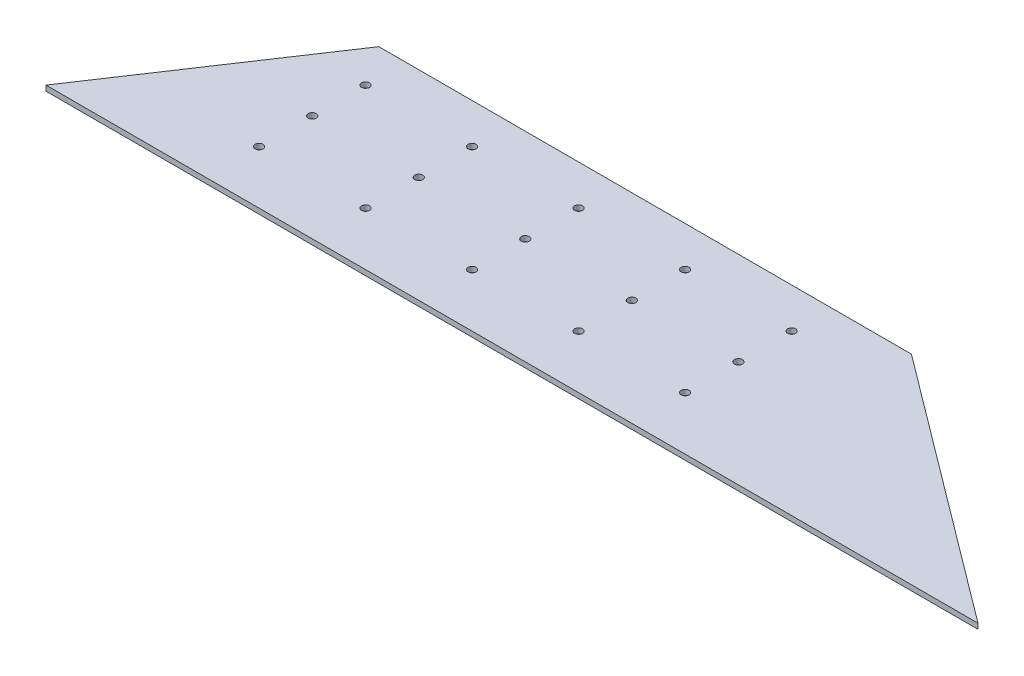
from build123d import *

# Parameters (mm, degrees)
SKETCH1_R           = 1.5
BOSS_EXTRUDE1_DEPTH = 2


with BuildPart() as part:
    # Sketch1 → Boss-Extrude1 (new body)
    with BuildSketch(Plane(origin=(0, 0, 0), x_dir=(1, 0, 0), z_dir=(0, 1, 0))):
        Polygon((-17.984046201, 0), (332.015953799, 0), (232.015953799, 75), (32.015953799, 75), align=None)
        with Locations((42.015953799, 20)):
            Circle(SKETCH1_R, mode=Mode.SUBTRACT)
        with Locations((82.015953799, 20)):
            Circle(SKETCH1_R, mode=Mode.SUBTRACT)
        with Locations((122.015953799, 20)):
            Circle(SKETCH1_R, mode=Mode.SUBTRACT)
        with Locations((162.015953799, 20)):
            Circle(SKETCH1_R, mode=Mode.SUBTRACT)
        with Locations((202.015953799, 20)):
            Circle(SKETCH1_R, mode=Mode.SUBTRACT)
        with Locations((42.015953799, 40)):
            Circle(SKETCH1_R, mode=Mode.SUBTRACT)
        with Locations((82.015953799, 40)):
            Circle(SKETCH1_R, mode=Mode.SUBTRACT)
        with Locations((122.015953799, 40)):
            Circle(SKETCH1_R, mode=Mode.SUBTRACT)
        with Locations((162.015953799, 40)):
            Circle(SKETCH1_R, mode=Mode.SUBTRACT)
        with Locations((202.015953799, 40)):
            Circle(SKETCH1_R, mode=Mode.SUBTRACT)
        with Locations((202.015953799, 60)):
            Circle(SKETCH1_R, mode=Mode.SUBTRACT)
        with Locations((162.015953799, 60)):
            Circle(SKETCH1_R, mode=Mode.SUBTRACT)
        with Locations((122.015953799, 60)):
            Circle(SKETCH1_R, mode=Mode.SUBTRACT)
        with Locations((82.015953799, 60)):
            Circle(SKETCH1_R, mode=Mode.SUBTRACT)
        with Locations((42.015953799, 60)):
            Circle(SKETCH1_R, mode=Mode.SUBTRACT)
    extrude(amount=BOSS_EXTRUDE1_DEPTH)


solid = part.part
